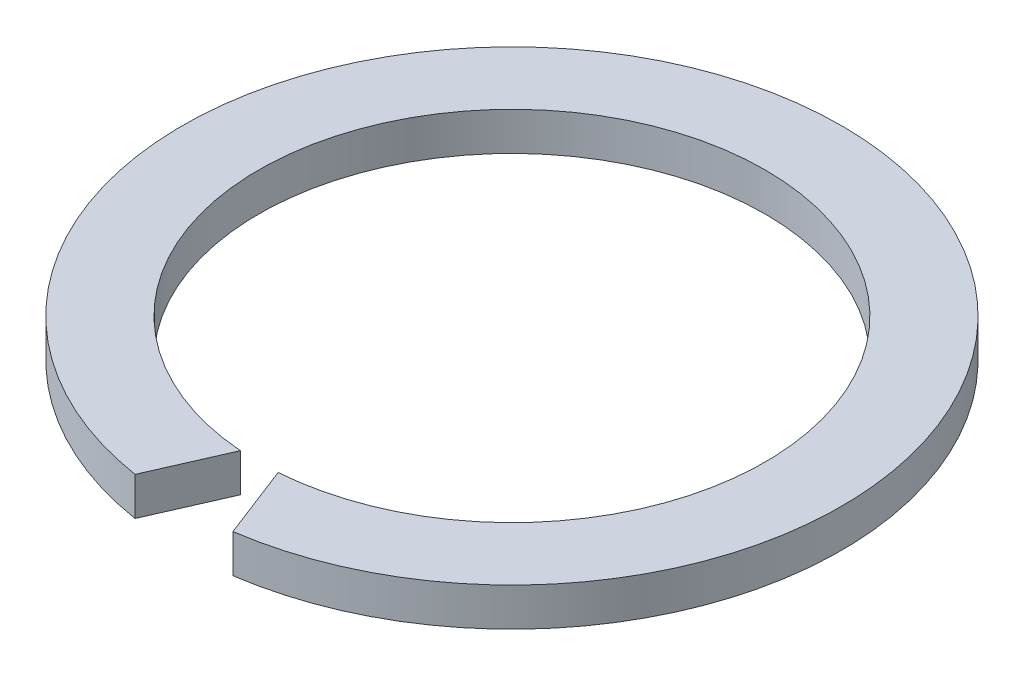
from build123d import *

# Parameters (mm, degrees)
SKETCH1_R               = 21.55
SKETCH1_R_2             = 16.55
BOSS_EXTRUDE1_DEPTH     = 2.5
CUT_EXTRUDE2_DEPTH      = 15
CUT_EXTRUDE2_DEPTH_BACK = 12


with BuildPart() as part:
    # Sketch1 → Boss-Extrude1 (new body)
    with BuildSketch(Plane(origin=(0, 0, 0), x_dir=(1, 0, 0), z_dir=(0, 1, 0))):
        Circle(SKETCH1_R)
        Circle(SKETCH1_R_2, mode=Mode.SUBTRACT)
    extrude(amount=BOSS_EXTRUDE1_DEPTH)

    # Sketch3 → Cut-Extrude2 (cut, two sides: drawn at the far end of the back side and taken through both)
    with BuildSketch(Plane(origin=(0, 0, 0), x_dir=(1, 0, 0), z_dir=(0, 1, 0)).offset(-CUT_EXTRUDE2_DEPTH_BACK)):
        Polygon((-3.94666429, -22.644619354), (3.596471207, -22.644619354), (1, -15.936255971), (0, -15.936255971), (-1, -15.936255971), align=None)
    extrude(amount=CUT_EXTRUDE2_DEPTH + CUT_EXTRUDE2_DEPTH_BACK, mode=Mode.SUBTRACT)


solid = part.part
